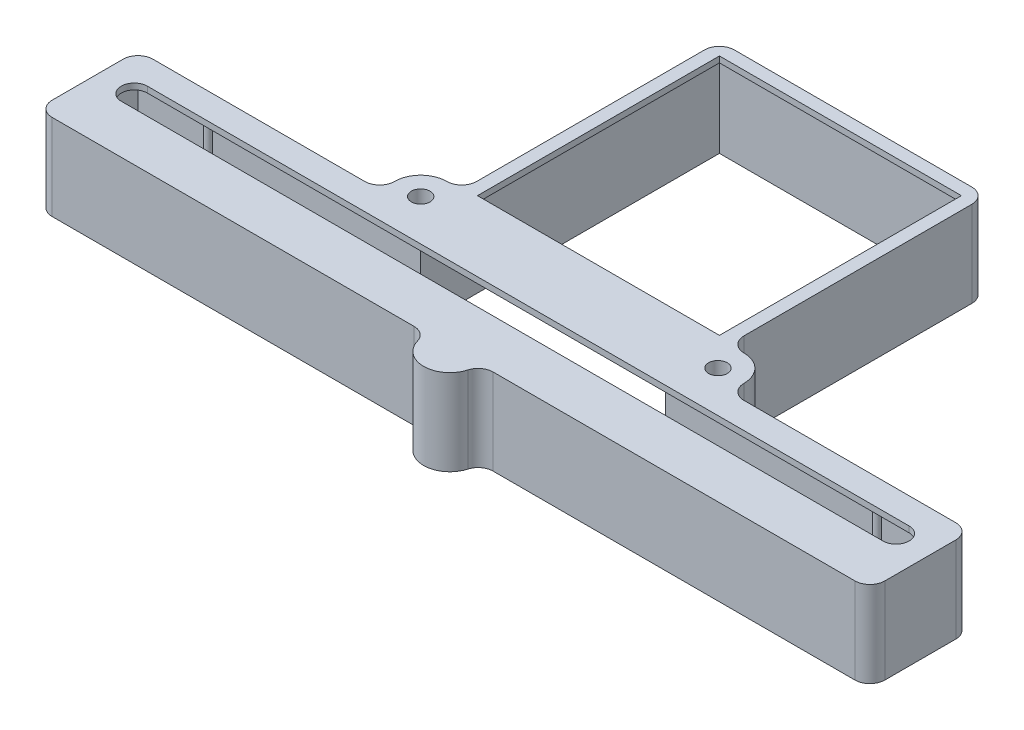
from build123d import *

# Parameters (mm, degrees)
BOSS_EXTRUDE1_DEPTH = 11.5
SKETCH2_W           = 32.4
SKETCH2_H           = 32.4
CUT_EXTRUDE1_DEPTH  = 8.7
SKETCH3_R           = 2
SKETCH3_W           = 108.5
SKETCH3_H           = 10.5
CUT_EXTRUDE2_DEPTH  = 10.7
CUT_EXTRUDE3_REACH  = 66.561
SKETCH5_W           = 32.8
SKETCH5_H           = 40
CUT_EXTRUDE4_DEPTH  = 10.7
SKETCH6_W           = 32.8
SKETCH6_H           = 1.5
BOSS_EXTRUDE2_DEPTH = 7.7
SKETCH8_R           = 2
SKETCH8_R_2         = 1.25
BOSS_EXTRUDE5_DEPTH = 11.5
FILLET1_R           = 2
SKETCH9_R           = 0.5
BOSS_EXTRUDE6_DEPTH = 10.7


with BuildPart() as part:
    # Sketch1 → Boss-Extrude1 (new body)
    with BuildSketch(Plane(origin=(0, 0, 0), x_dir=(1, 0, 0), z_dir=(0, 1, 0))):
        with BuildLine():
            Line((3.464101615, -26.75), (55.75, -26.75))
            Line((55.75, -26.75), (55.75, -13.25))
            Line((55.75, -13.25), (17.9, -13.25))
            Line((17.9, -13.25), (17.9, 26.75))
            Line((17.9, 26.75), (-17.9, 26.75))
            Line((-17.9, 26.75), (-17.9, -13.25))
            Line((-17.9, -13.25), (-55.75, -13.25))
            Line((-55.75, -13.25), (-55.75, -26.75))
            Line((-55.75, -26.75), (-3.464101615, -26.75))
            ThreePointArc((-3.464101615, -26.75), (0, -30.75), (3.464101615, -26.75))
        make_face()
    extrude(amount=BOSS_EXTRUDE1_DEPTH)

    # Sketch2 → Cut-Extrude1 (cut)
    with BuildSketch(Plane(origin=(0, 11.5, 0), x_dir=(1, 0, 0), z_dir=(0, 1, 0))):
        with Locations((0, 8.85)):
            Rectangle(SKETCH2_W, SKETCH2_H)
    extrude(amount=-CUT_EXTRUDE1_DEPTH, mode=Mode.SUBTRACT)

    # Sketch3 → Cut-Extrude2 (cut)
    with BuildSketch(Plane.XZ):
        with Locations((0, 27.25)):
            Circle(SKETCH3_R)
        with BuildLine():
            Line((-2, 27.25), (-2, 25.25))
            Line((-2, 25.25), (-1e-08, 25.25))
            ThreePointArc((-1e-08, 25.25), (-1.414213566, 25.835786441), (-2, 27.25))
        make_face()
        with BuildLine():
            ThreePointArc((2, 27.25), (1.414213559, 25.835786434), (-1e-08, 25.25))
            Line((-1e-08, 25.25), (2, 25.25))
            Line((2, 25.25), (2, 27.25))
        make_face()
        with Locations((0, 20)):
            Rectangle(SKETCH3_W, SKETCH3_H)
    extrude(amount=-CUT_EXTRUDE2_DEPTH, mode=Mode.SUBTRACT)

    # Sketch4 → Cut-Extrude3 (cut, up to next)
    with BuildSketch(Plane.XZ.offset(-10.7), mode=Mode.PRIVATE) as cut_extrude3_sk1:
        with BuildLine():
            Line((51, 16.75), (-51, 16.75))
            ThreePointArc((-51, 16.75), (-52.75, 18.5), (-51, 20.25))
            Line((-51, 20.25), (51, 20.25))
            ThreePointArc((51, 20.25), (52.75, 18.5), (51, 16.75))
        make_face()
    cut_extrude3_tool1 = extrude(cut_extrude3_sk1.sketch, amount=-CUT_EXTRUDE3_REACH, mode=Mode.PRIVATE) & part.part
    add(cut_extrude3_tool1.solids().sort_by_distance((0, 10.7, 18.5))[0], mode=Mode.SUBTRACT)

    # Sketch5 → Cut-Extrude4 (cut)
    with BuildSketch(Plane.XZ):
        with Locations((0, -5.25)):
            Rectangle(SKETCH5_W, SKETCH5_H)
    extrude(amount=-CUT_EXTRUDE4_DEPTH, mode=Mode.SUBTRACT)

    # Sketch6 → Boss-Extrude2 (add)
    with BuildSketch(Plane.XZ.offset(-10.7)):
        with Locations((0, 8.1)):
            Rectangle(SKETCH6_W, SKETCH6_H)
    extrude(amount=BOSS_EXTRUDE2_DEPTH)

    # Sketch8 → Boss-Extrude5 (add)
    # profile 1 of 10: a face of its own
    with BuildSketch(Plane(origin=(0, 11.5, 0), x_dir=(1, 0, 0), z_dir=(0, 1, 0))):
        with BuildLine():
            Line((-17.9, -7.75), (-19.9, -7.75))
            ThreePointArc((-19.9, -7.75), (-18.851902827, -7.910614979), (-17.9, -8.377718677))
            Line((-17.9, -8.377718677), (-17.9, -7.75))
        make_face()
    # profile 2 of 10: a face of its own
    with BuildSketch(Plane(origin=(0, 11.5, 0), x_dir=(1, 0, 0), z_dir=(0, 1, 0))):
        with BuildLine():
            ThreePointArc((-17.9, -8.377718677), (-18.851902827, -7.910614979), (-19.9, -7.75))
            ThreePointArc((-19.9, -7.75), (-22.374873734, -8.775126266), (-23.4, -11.25))
            ThreePointArc((-23.4, -11.25), (-23.239385021, -12.298097173), (-22.772281323, -13.25))
            Line((-22.772281323, -13.25), (-19.9, -13.25))
            ThreePointArc((-19.9, -13.25), (-21.314213562, -9.835786438), (-17.9, -11.25))
            Line((-17.9, -11.25), (-17.9, -8.377718677))
        make_face()
    # profile 3 of 10: a face of its own
    with BuildSketch(Plane(origin=(0, 11.5, 0), x_dir=(1, 0, 0), z_dir=(0, 1, 0))):
        with Locations((-19.9, -11.25)):
            Circle(SKETCH8_R)
        with Locations(Location((-19.9, -11.25, 0), (0, 0, 270))):
            Circle(SKETCH8_R_2, mode=Mode.SUBTRACT)
    # profile 4 of 10: a face of its own
    with BuildSketch(Plane(origin=(0, 11.5, 0), x_dir=(1, 0, 0), z_dir=(0, 1, 0))):
        with BuildLine():
            Line((-17.9, -13.25), (-17.9, -11.25))
            ThreePointArc((-17.9, -11.25), (-18.485786438, -12.664213562), (-19.9, -13.25))
            Line((-19.9, -13.25), (-17.9, -13.25))
        make_face()
    # profile 5 of 10: a face of its own
    with BuildSketch(Plane(origin=(0, 11.5, 0), x_dir=(1, 0, 0), z_dir=(0, 1, 0))):
        with BuildLine():
            ThreePointArc((-22.772281323, -13.25), (-23.239385021, -12.298097173), (-23.4, -11.25))
            Line((-23.4, -11.25), (-23.4, -13.25))
            Line((-23.4, -13.25), (-22.772281323, -13.25))
        make_face()
    # profile 6 of 10: a face of its own
    with BuildSketch(Plane(origin=(0, 11.5, 0), x_dir=(1, 0, 0), z_dir=(0, 1, 0))):
        with BuildLine():
            Line((17.9, -13.25), (19.9, -13.25))
            ThreePointArc((19.9, -13.25), (18.485786438, -12.664213562), (17.9, -11.25))
            Line((17.9, -11.25), (17.9, -13.25))
        make_face()
    # profile 7 of 10: a face of its own
    with BuildSketch(Plane(origin=(0, 11.5, 0), x_dir=(1, 0, 0), z_dir=(0, 1, 0))):
        with Locations((19.9, -11.25)):
            Circle(SKETCH8_R)
        with Locations(Location((19.9, -11.25, 0), (0, 0, 270))):
            Circle(SKETCH8_R_2, mode=Mode.SUBTRACT)
    # profile 8 of 10: a face of its own
    with BuildSketch(Plane(origin=(0, 11.5, 0), x_dir=(1, 0, 0), z_dir=(0, 1, 0))):
        with BuildLine():
            ThreePointArc((22.772281323, -13.25), (23.239385021, -12.298097173), (23.4, -11.25))
            ThreePointArc((23.4, -11.25), (22.374873734, -8.775126266), (19.9, -7.75))
            ThreePointArc((19.9, -7.75), (18.851902827, -7.910614979), (17.9, -8.377718677))
            Line((17.9, -8.377718677), (17.9, -11.25))
            ThreePointArc((17.9, -11.25), (19.9, -9.25), (21.9, -11.25))
            ThreePointArc((21.9, -11.25), (21.314213562, -12.664213562), (19.9, -13.25))
            Line((19.9, -13.25), (22.772281323, -13.25))
        make_face()
    # profile 9 of 10: a face of its own
    with BuildSketch(Plane(origin=(0, 11.5, 0), x_dir=(1, 0, 0), z_dir=(0, 1, 0))):
        with BuildLine():
            ThreePointArc((17.9, -8.377718677), (18.851902827, -7.910614979), (19.9, -7.75))
            Line((19.9, -7.75), (17.9, -7.75))
            Line((17.9, -7.75), (17.9, -8.377718677))
        make_face()
    # profile 10 of 10: a face of its own
    with BuildSketch(Plane(origin=(0, 11.5, 0), x_dir=(1, 0, 0), z_dir=(0, 1, 0))):
        with BuildLine():
            Line((23.4, -13.25), (23.4, -11.25))
            ThreePointArc((23.4, -11.25), (23.239385021, -12.298097173), (22.772281323, -13.25))
            Line((22.772281323, -13.25), (23.4, -13.25))
        make_face()
    extrude(amount=-BOSS_EXTRUDE5_DEPTH)

    # Fillet1
    fillet1_edges = [part.edges().sort_by_distance(p)[0] for p in [
        (55.75, 5.75, 26.75),
        (55.75, 5.75, 13.25),
        (-55.75, 5.75, 26.75),
        (-55.75, 5.75, 13.25),
        (-17.9, 5.75, -26.75),
        (17.9, 5.75, -26.75),
        (-17.9, 5.75, 7.75),
        (-23.4, 5.75, 13.25),
        (23.4, 5.75, 13.25),
        (17.9, 5.75, 7.75),
        (3.464101615, 5.75, 26.75),
        (-3.464101615, 5.75, 26.75),
    ]]
    fillet(fillet1_edges, radius=FILLET1_R - 0.0001)  # a hair under: the kernel refuses the full size

    # Sketch9 → Boss-Extrude6 (add)
    with BuildSketch(Plane.XZ.offset(-10.7)):
        with Locations((-35.325, 25.25)):
            Circle(SKETCH9_R)
        with Locations((-44.7875, 14.75)):
            Circle(SKETCH9_R)
        with Locations((35.325, 25.25)):
            Circle(SKETCH9_R)
        with Locations((44.7875, 14.75)):
            Circle(SKETCH9_R)
    extrude(amount=BOSS_EXTRUDE6_DEPTH)


solid = part.part
